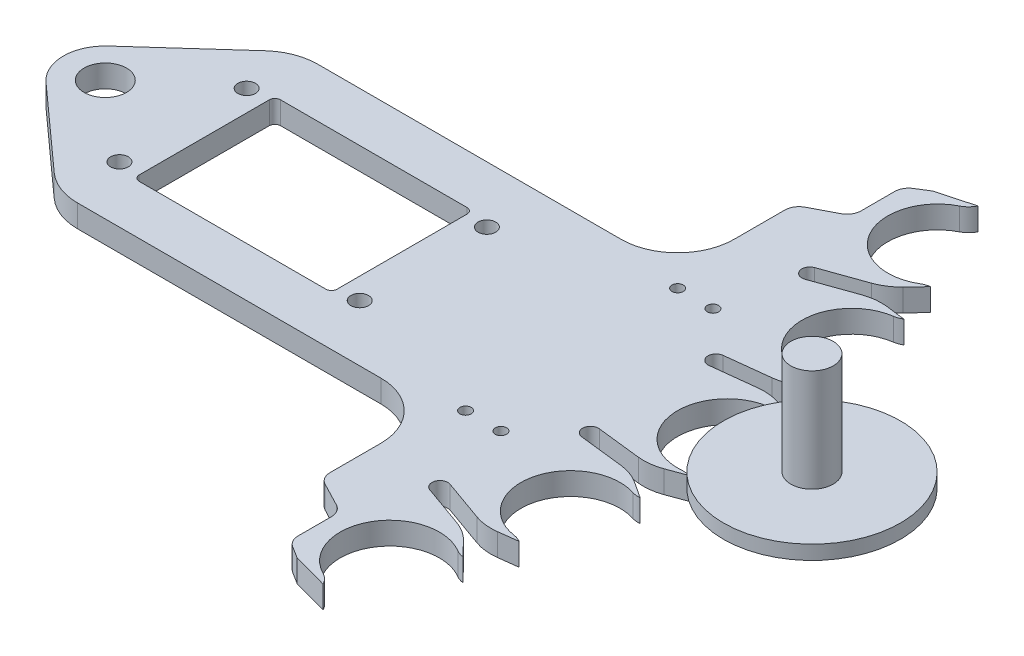
from build123d import *

# Parameters (mm, degrees)
SKETCH1_R                      = 2
BASE_BOSS_EXTRUDE1_DEPTH       = 3.175
SKETCH4_R                      = 12.526333531
BOSS_EXTRUDE2_DEPTH            = 2
SKETCH4_3_R                    = 1
BOSS_EXTRUDE3_DEPTH            = 3.175
BOSS_EXTRUDE4_START            = -2
SKETCH6_R                      = 3
BOSS_EXTRUDE4_DEPTH            = 16.5
SKETCH7_W                      = 28
SKETCH7_H                      = 20
RECTANGLE_CUT_EXTRUDE1_DEPTH   = 10
SKETCH3_W                      = 1.25
SKETCH3_H                      = 3.175
M3X0_5_TAPPED_HOLE1_AT_2_COUNT = 2
M3X0_5_TAPPED_HOLE1_AT_2_PITCH = 34
M3X0_5_TAPPED_HOLE1_AT_3_COUNT = 2
M3X0_5_TAPPED_HOLE1_AT_3_PITCH = 18
M3X0_5_TAPPED_HOLE1_AT_4_COUNT = 2
M3X0_5_TAPPED_HOLE1_AT_4_PITCH = 38.470768123
CHAMFER1_SIZE                  = 4
CHAMFER2_SIZE                  = 4
CHAMFER3_SIZE                  = 5
CHAMFER4_SIZE                  = 5
FILLET9_R                      = 3
FILLET10_R                     = 7
FILLET6_R                      = 2
FILLET7_R                      = 0.8
SKETCH8_R                      = 3
CUT_EXTRUDE1_DEPTH             = 123.807551697
FILLET1_R                      = 8
M2_TAPPED_HOLE1_AT_2_COUNT     = 2
M2_TAPPED_HOLE1_AT_2_PITCH     = 30
M2_TAPPED_HOLE1_AT_3_COUNT     = 2
M2_TAPPED_HOLE1_AT_3_PITCH     = 30.413812651
M2_TAPPED_HOLE1_AT_4_COUNT     = 2
M2_TAPPED_HOLE1_AT_4_PITCH     = 5


with BuildPart() as part:
    # Sketch1 → Base Boss-Extrude1 (new body)
    with BuildSketch(Plane(origin=(0, 0, 0), x_dir=(1, 0, 0), z_dir=(0, 1, 0))):
        with BuildLine():
            Line((84.404055553, -31.240284988), (73.146130481, -27.232692294))
            ThreePointArc((73.146130481, -27.232692294), (72.463565841, -25.795557815), (73.90070032, -25.112993174))
            Line((73.90070032, -25.112993174), (85.158625392, -29.120585869))
            ThreePointArc((85.158625392, -29.120585869), (85.527078047, -28.019973605), (85.881306759, -26.914701361))
            ThreePointArc((85.881306759, -26.914701361), (78.878198486, -18.302034453), (88.95836429, -13.653183615))
            ThreePointArc((88.95836429, -13.653183615), (89.127036062, -12.504856768), (89.280885186, -11.354450248))
            Line((89.280885186, -11.354450248), (77.408482838, -9.995134754))
            ThreePointArc((77.408482838, -9.995134754), (76.418754233, -8.749467347), (77.66442164, -7.759738742))
            Line((77.66442164, -7.759738742), (89.536823988, -9.119054237))
            ThreePointArc((89.536823988, -9.119054237), (89.646976318, -7.963644708), (89.742219529, -6.806910753))
            ThreePointArc((89.742219529, -6.806910753), (80.973666469, 0), (89.742219529, 6.806910753))
            ThreePointArc((89.742219529, 6.806910753), (89.646976318, 7.963644708), (89.536823988, 9.119054237))
            Line((89.536823988, 9.119054237), (77.66442164, 7.759738742))
            ThreePointArc((77.66442164, 7.759738742), (76.418754233, 8.749467347), (77.408482838, 9.995134754))
            Line((77.408482838, 9.995134754), (89.280885186, 11.354450248))
            ThreePointArc((89.280885186, 11.354450248), (89.127036062, 12.504856768), (88.95836429, 13.653183615))
            ThreePointArc((88.95836429, 13.653183615), (78.878198486, 18.302034453), (85.881306759, 26.914701361))
            ThreePointArc((85.881306759, 26.914701361), (85.527078047, 28.019973605), (85.158625392, 29.120585869))
            Line((85.158625392, 29.120585869), (73.90070032, 25.112993174))
            ThreePointArc((73.90070032, 25.112993174), (72.463565841, 25.795557815), (73.146130481, 27.232692294))
            Line((73.146130481, 27.232692294), (84.404055553, 31.240284988))
            ThreePointArc((84.404055553, 31.240284988), (83.99416771, 32.326147167), (83.570310863, 33.406633208))
            ThreePointArc((83.570310863, 33.406633208), (72.700249204, 35.656814597), (77.57545438, 45.629473784))
            ThreePointArc((77.57545438, 45.629473784), (76.980573902, 46.626078987), (76.372890845, 47.614929843))
            Line((76.372890845, 47.614929843), (69.482339398, 43.318992893))
            Line((69.482339398, 43.318992893), (69.482339398, 36.260244959))
            Line((69.482339398, 36.260244959), (63.982339398, 33.389999814))
            Line((63.982339398, 33.389999814), (63.982339398, 17))
            Line((63.982339398, 17), (10, 17))
            Line((10, 17), (-3.976078427, 4.415882461))
            ThreePointArc((-3.976078427, 4.415882461), (-5.94215597, 0), (-3.976078427, -4.415882461))
            Line((-3.976078427, -4.415882461), (10, -17))
            Line((10, -17), (63.982339398, -17))
            Line((63.982339398, -17), (63.982339398, -33.389999814))
            Line((63.982339398, -33.389999814), (69.482339398, -36.260244959))
            Line((69.482339398, -36.260244959), (69.482339398, -43.318992893))
            Line((69.482339398, -43.318992893), (76.372890845, -47.614929843))
            ThreePointArc((76.372890845, -47.614929843), (76.980573902, -46.626078987), (77.57545438, -45.629473784))
            ThreePointArc((77.57545438, -45.629473784), (72.700249204, -35.656814597), (83.570310863, -33.406633208))
            ThreePointArc((83.570310863, -33.406633208), (83.99416771, -32.326147167), (84.404055553, -31.240284988))
        make_face()
        with Locations(Location((0, 0, 0), (0, 0, 270))):
            Circle(SKETCH1_R, mode=Mode.SUBTRACT)
    extrude(amount=BASE_BOSS_EXTRUDE1_DEPTH)

    # Sketch7 → Rectangle Cut-Extrude1 (cut)
    with BuildSketch(Plane(origin=(0, 3.175, 0), x_dir=(1, 0, 0), z_dir=(0, 1, 0))):
        with Locations((28, 0)):
            Rectangle(SKETCH7_W, SKETCH7_H)
    extrude(amount=-RECTANGLE_CUT_EXTRUDE1_DEPTH, mode=Mode.SUBTRACT)

    # Sketch3 → M3x0.5 Tapped Hole1 (revolve, cut)
    with BuildSketch(Plane(origin=(45, 3.175, -9), x_dir=(0, 0, 1), z_dir=(1, 0, 0))):
        with Locations((0.625, 1.5875)):
            Rectangle(SKETCH3_W, SKETCH3_H)
    m3x0_5_tapped_hole1 = revolve(axis=Axis((45, 9.525, -9), (0, -1, 0)), mode=Mode.SUBTRACT)

    # M3x0.5 Tapped Hole1 at 2: M3x0.5 Tapped Hole1 ×2
    with Locations(*[(-i * M3X0_5_TAPPED_HOLE1_AT_2_PITCH, 0, 0) for i in range(1, M3X0_5_TAPPED_HOLE1_AT_2_COUNT)]):
        add(m3x0_5_tapped_hole1, mode=Mode.SUBTRACT)

    # M3x0.5 Tapped Hole1 at 3: M3x0.5 Tapped Hole1 ×2
    with Locations(*[(0, 0, i * M3X0_5_TAPPED_HOLE1_AT_3_PITCH) for i in range(1, M3X0_5_TAPPED_HOLE1_AT_3_COUNT)]):
        add(m3x0_5_tapped_hole1, mode=Mode.SUBTRACT)

    # M3x0.5 Tapped Hole1 at 4: M3x0.5 Tapped Hole1 ×2
    with Locations(*[Vector(-0.88378791634706, 0, 0.4678877204190361) * (i * M3X0_5_TAPPED_HOLE1_AT_4_PITCH) for i in range(1, M3X0_5_TAPPED_HOLE1_AT_4_COUNT)]):
        add(m3x0_5_tapped_hole1, mode=Mode.SUBTRACT)

    # Chamfer1
    # the kernel refuses this chamfer: 4, 2 mm, written as the material it takes off along each edge
    with BuildSketch(Plane(origin=(84.404055553, -10.35888597, -31.240284988), x_dir=(-0.357458112725079, 0, -0.9339291716436663), z_dir=(0, 1, 0))) as chamfer1_piece_1:
        with BuildLine():
            Line((1.989401847, 0), (CHAMFER1_SIZE * 0.0235506055191, CHAMFER1_SIZE * 0.999722646027))
            Line((CHAMFER1_SIZE * 0.0235506055191, CHAMFER1_SIZE * 0.999722646027), (0, 0))
            ThreePointArc((0, 0), (1.028937008, -0.005490489), (1.989401847, 0))
        make_face()
    extrude(amount=23.89277194, mode=Mode.SUBTRACT)
    with BuildSketch(Plane(origin=(89.280885186, -10.35888597, -11.354450248), x_dir=(-0.993509338580465, 0, 0.1137505786948226), z_dir=(0, 1, 0)), Plane(origin=(89.536823988, -10.35888597, 9.119054237), x_dir=(-0.9935093385804683, 0, -0.1137505786947941), z_dir=(0, 1, 0)), Plane(origin=(85.158625392, -10.35888597, 29.120585869), x_dir=(-0.9420884976800207, 0, -0.3353643727932379), z_dir=(0, 1, 0))) as chamfer1_piece_2:
        with BuildLine():
            Line((CHAMFER1_SIZE, 0), (0.046851618, -1.988850078))
            ThreePointArc((0.046851618, -1.988850078), (0.018743123, -1.028780933), (0, 0))
            Line((0, 0), (CHAMFER1_SIZE, 0))
        make_face()
    extrude(amount=23.89277194, mode=Mode.SUBTRACT)

    # Chamfer2
    # the kernel refuses this chamfer: 4, 2 mm, written as the material it takes off along each edge
    with BuildSketch(Plane(origin=(85.158625392, -10.35888597, -29.120585869), x_dir=(-0.9420884976800226, 0, 0.3353643727932324), z_dir=(0, 1, 0)), Plane(origin=(89.536823988, -10.35888597, -9.119054237), x_dir=(-0.9935093385804687, 0, 0.1137505786947902), z_dir=(0, 1, 0)), Plane(origin=(89.280885186, -10.35888597, 11.354450248), x_dir=(-0.9935093385804648, 0, -0.11375057869482483), z_dir=(0, 1, 0)), Plane(origin=(84.404055553, -10.35888597, 31.240284988), x_dir=(-0.9420884976800115, 0, -0.33536437279326364), z_dir=(0, 1, 0))) as chamfer2_piece_1:
        with BuildLine():
            Line((CHAMFER2_SIZE, 0), (0.046851618, 1.988850078))
            ThreePointArc((0.046851618, 1.988850078), (0.018743123, 1.028780933), (0, 0))
            Line((0, 0), (CHAMFER2_SIZE, 0))
        make_face()
    extrude(amount=23.89277194, mode=Mode.SUBTRACT)

    # Chamfer3
    # the kernel refuses this chamfer: 5, 1.5 mm, written as the material it takes off along each edge
    with BuildSketch(Plane(origin=(76.372890845, -12.979708339, 47.614929843), x_dir=(-0.8485876760573847, 0, -0.5290547760331883), z_dir=(0, 1, 0))) as chamfer3_piece_1:
        with BuildLine():
            Line((CHAMFER3_SIZE, 0), (0.012438743, -1.496268377))
            ThreePointArc((0.012438743, -1.496268377), (0.003346069, -0.776067792), (0, 0))
            Line((0, 0), (CHAMFER3_SIZE, 0))
        make_face()
    extrude(amount=29.134416678, mode=Mode.SUBTRACT)

    # Chamfer4
    # the kernel refuses this chamfer: 5, 1.5 mm, written as the material it takes off along each edge
    with BuildSketch(Plane(origin=(76.372890845, -12.979708339, -47.614929843), x_dir=(-0.8485876760573731, 0, 0.5290547760332069), z_dir=(0, 1, 0))) as chamfer4_piece_1:
        with BuildLine():
            Line((CHAMFER4_SIZE, 0), (0.012438743, 1.496268377))
            ThreePointArc((0.012438743, 1.496268377), (0.003346069, 0.776067792), (0, 0))
            Line((0, 0), (CHAMFER4_SIZE, 0))
        make_face()
    extrude(amount=29.134416678, mode=Mode.SUBTRACT)

    # Fillet9
    # the kernel refuses this fillet: 3 mm, written as the material it takes off along each edge
    with BuildSketch(Plane(origin=(77.57545438, -4.613921253, 45.629473784), x_dir=(-0.9437070419178525, 0, -0.33078243459206924), z_dir=(0, 1, 0))) as fillet9_piece_1:
        with BuildLine():
            CenterArc((2.239565276, 2.974015222), FILLET9_R, 226.201834193, 36.251580599)
            Line((0.163205072, 0.808668067), (0.121677868, 0.765361124))
            ThreePointArc((0.121677868, 0.765361124), (0.021861793, 0.416390887), (-0.058867954, 0.011600172))
            Line((-0.058867954, 0.011600172), (0.007879936, -0.059480304))
            ThreePointArc((0.007879936, -0.059480304), (0.922784251, 0.000859239), (1.837688566, -0.059480304))
            Line((1.837688566, -0.059480304), (1.845568501, 0))
        make_face()
    extrude(amount=12.402842505, mode=Mode.SUBTRACT)
    with BuildSketch(Plane(origin=(83.570310863, -2.994713801, 33.406633208), x_dir=(0.3694721758404633, 0, -0.929241793765064), z_dir=(0, 1, 0)), Plane(origin=(88.95836429, -2.994713801, 13.653183615), x_dir=(0.14987939691227342, 0, -0.9887042866202276), z_dir=(0, 1, 0)), Plane(origin=(89.742219529, -2.994713801, -6.806910753), x_dir=(-0.07747065647813188, 0, -0.9969946325757462), z_dir=(0, 1, 0)), Plane(origin=(85.881306759, -2.994713801, -26.914701361), x_dir=(-0.30081107841240035, 0, -0.9536837500473461), z_dir=(0, 1, 0))) as fillet9_piece_2:
        with BuildLine():
            CenterArc((3.250866962, 0.69242963), FILLET9_R, 170.980179681, 22.364577563)
            Line((0.287964463, 1.162758009), (0.228706413, 1.172164577))
            ThreePointArc((0.228706413, 1.172164577), (0.110566007, 0.589654747), (-0.056799034, 0.019335712))
            Line((-0.056799034, 0.019335712), (-0.000110623, -0.059999898))
            ThreePointArc((-0.000110623, -0.059999898), (0.165935176, -0.060152969), (0.27349042, -0.013848593))
            Line((0.27349042, -0.013848593), (0.331870352, 0))
        make_face()
    extrude(amount=9.164427603, mode=Mode.SUBTRACT)
    with BuildSketch(Plane(origin=(85.881306759, -2.994713801, 26.914701361), x_dir=(-0.9980305287629706, 0, -0.0627300857412545), z_dir=(0, 1, 0)), Plane(origin=(89.742219529, -2.994713801, 6.806910753), x_dir=(-0.9863816449930947, 0, 0.16447264338094886), z_dir=(0, 1, 0)), Plane(origin=(88.95836429, -2.994713801, -13.653183615), x_dir=(-0.9236808267675535, 0, 0.38316279864048475), z_dir=(0, 1, 0)), Plane(origin=(83.570310863, -2.994713801, -33.406633208), x_dir=(-0.8131732663286447, 0, 0.582021682524288), z_dir=(0, 1, 0))) as fillet9_piece_3:
        with BuildLine():
            CenterArc((1.453613244, 2.989080683), FILLET9_R, 242.745448438, 22.364577563)
            Line((0.079779634, 0.322138387), (0.052302961, 0.268799541))
            ThreePointArc((0.052302961, 0.268799541), (-0.018499191, 0.175529605), (-0.058267018, 0.014316235))
            Line((-0.058267018, 0.014316235), (0.005114554, -0.059781614))
            ThreePointArc((0.005114554, -0.059781614), (0.59894276, -0.034425746), (1.192770966, -0.059781614))
            Line((1.192770966, -0.059781614), (1.197885521, 0))
        make_face()
    extrude(amount=9.164427603, mode=Mode.SUBTRACT)
    with BuildSketch(Plane(origin=(77.57545438, -4.613921253, -45.629473784), x_dir=(-0.5109392993386291, 0, -0.859616793921193), z_dir=(0, 1, 0))) as fillet9_piece_4:
        with BuildLine():
            CenterArc((3.358292449, 1.606950837), FILLET9_R, 176.136441891, 36.251580599)
            Line((0.365110439, 1.809092994), (0.305246798, 1.813135837))
            ThreePointArc((0.305246798, 1.813135837), (0.183397476, 0.904376513), (-0.056745851, 0.019491239))
            Line((-0.056745851, 0.019491239), (-0.000274991, -0.05999937))
            ThreePointArc((-0.000274991, -0.05999937), (0.412486345, -0.060945255), (0.774306294, -0.032139017))
            Line((0.774306294, -0.032139017), (0.824972689, 0))
        make_face()
    extrude(amount=12.402842505, mode=Mode.SUBTRACT)

    # Fillet10
    fillet10_edges = [part.edges().sort_by_distance(p)[0] for p in [
        (81.390271401, 1.5875, 27.779128377),
        (85.562786634, 1.5875, 8.664051922),
        (85.306847831, 1.5875, -10.899447934),
        (80.635701563, 1.5875, -29.898827497),
        (80.635701563, 1.5875, 29.898827497),
        (85.306847831, 1.5875, 10.899447934),
        (85.562786634, 1.5875, -8.664051922),
        (81.390271401, 1.5875, -27.779128377),
    ]]
    fillet(fillet10_edges, radius=FILLET10_R)

    # Fillet6
    fillet6_edges = [part.edges().sort_by_distance(p)[0] for p in [
        (69.482339398, 1.5875, 43.318992893),
        (69.482339398, 1.5875, 36.260244959),
        (63.982339398, 1.5875, 33.389999814),
        (63.982339398, 1.5875, -33.389999814),
        (69.482339398, 1.5875, -36.260244959),
        (69.482339398, 1.5875, -43.318992893),
    ]]
    fillet(fillet6_edges, radius=FILLET6_R)

    # Fillet7
    fillet7_edges = [part.edges().sort_by_distance(p)[0] for p in [
        (14, 1.5875, 10),
        (14, 1.5875, -10),
        (42, 1.5875, -10),
        (42, 1.5875, 10),
    ]]
    fillet(fillet7_edges, radius=FILLET7_R)

    # Sketch8 → Cut-Extrude1 (cut, through all)
    with BuildSketch(Plane(origin=(0, 3.175, 0), x_dir=(1, 0, 0), z_dir=(0, 1, 0))):
        with Locations(Location((0, 0, 0), (0, 0, 270))):
            Circle(SKETCH8_R)
    extrude(amount=-CUT_EXTRUDE1_DEPTH, mode=Mode.SUBTRACT)

    # Fillet1
    fillet1_edges = [part.edges().sort_by_distance(p)[0] for p in [
        (63.982339398, 1.5875, 17),
        (10, 1.5875, 17),
        (10, 1.5875, -17),
        (63.982339398, 1.5875, -17),
    ]]
    fillet(fillet1_edges, radius=FILLET1_R)

    # Sketch17 → M2 Tapped Hole1 (revolve, cut)
    with BuildSketch(Plane(origin=(70.982339398, 3.175, 15), x_dir=(0, 0, 1), z_dir=(1, 0, 0))):
        Polygon((0, 0), (0, 6.480688495), (0.8, 6), (0.8, 0), align=None)
    m2_tapped_hole1 = revolve(axis=Axis((70.982339398, 9.525, 15), (0, -1, 0)), mode=Mode.SUBTRACT)

    # M2 Tapped Hole1 at 2: M2 Tapped Hole1 ×2
    with Locations(*[(0, 0, -i * M2_TAPPED_HOLE1_AT_2_PITCH) for i in range(1, M2_TAPPED_HOLE1_AT_2_COUNT)]):
        add(m2_tapped_hole1, mode=Mode.SUBTRACT)

    # M2 Tapped Hole1 at 3: M2 Tapped Hole1 ×2
    with Locations(*[Vector(-0.1643989873053573, 0, -0.9863939238321437) * (i * M2_TAPPED_HOLE1_AT_3_PITCH) for i in range(1, M2_TAPPED_HOLE1_AT_3_COUNT)]):
        add(m2_tapped_hole1, mode=Mode.SUBTRACT)

    # M2 Tapped Hole1 at 4: M2 Tapped Hole1 ×2
    with Locations(*[(-i * M2_TAPPED_HOLE1_AT_4_PITCH, 0, 0) for i in range(1, M2_TAPPED_HOLE1_AT_4_COUNT)]):
        add(m2_tapped_hole1, mode=Mode.SUBTRACT)


with BuildPart() as body_2:
    # Sketch4 → Boss-Extrude2 (new body)
    with BuildSketch(Plane(origin=(0, 3.175, 0), x_dir=(1, 0, 0), z_dir=(0, 1, 0))):
        with Locations(Location((100, 0, 0), (0, 0, 270))):
            Circle(SKETCH4_R)
    extrude(amount=BOSS_EXTRUDE2_DEPTH)

    # Sketch4<3> → Boss-Extrude3 (add)
    with BuildSketch(Plane(origin=(0, 3.175, 0), x_dir=(1, 0, 0), z_dir=(0, 1, 0))):
        with BuildLine():
            ThreePointArc((93.143315787, 0.78376406), (99.607482592, -6.890162159), (106.901333531, 0))
            ThreePointArc((106.901333531, 0), (100.011171371, 0.196099731), (93.143315787, 0.78376406))
        make_face()
        with Locations(Location((100.570253624, 10.010103639, 0), (0, 0, 270))):
            Circle(SKETCH4_3_R)
    extrude(amount=-BOSS_EXTRUDE3_DEPTH)

    # Sketch6 → Boss-Extrude4 (add)
    with BuildSketch(Plane(origin=(0, 5.175, 0), x_dir=(1, 0, 0), z_dir=(0, 1, 0)).offset(BOSS_EXTRUDE4_START)):
        with Locations(Location((100, 0, 0), (0, 0, 270))):
            Circle(SKETCH6_R)
    extrude(amount=BOSS_EXTRUDE4_DEPTH)


solid = Compound([part.part, body_2.part])
